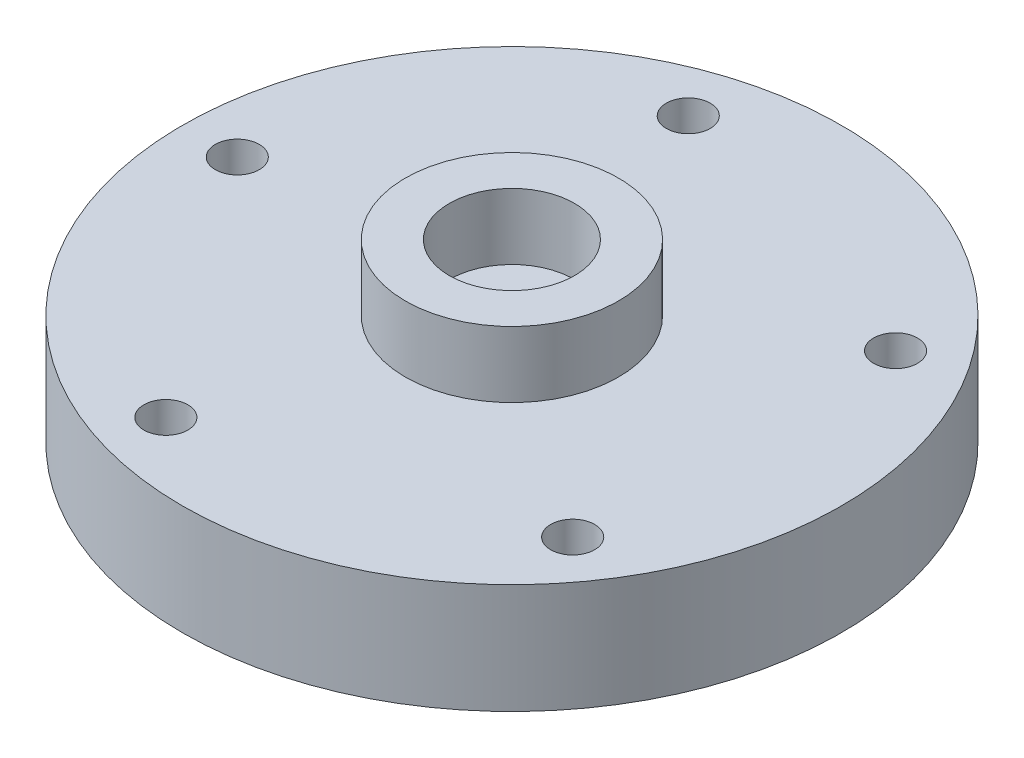
from build123d import *

# Parameters (mm, degrees)
BOSS_EXTRUDE1_DEPTH      = 2
BOSS_EXTRUDE1_DEPTH_BACK = 3
SKETCH1_R                = 15
SKETCH1_R_2              = 1
SKETCH2_R                = 4.85
SKETCH2_R_2              = 2.85
BOSS_EXTRUDE3_DEPTH      = 3
SKETCH5_R                = 2
CUT_EXTRUDE2_DEPTH       = 1


with BuildPart() as part:
    # Sketch1 → Boss-Extrude1 (new, two sides: drawn at the far end of the back side and taken through both)
    with BuildSketch(Plane(origin=(0, 0, 0), x_dir=(1, 0, 0), z_dir=(0, 1, 0)).offset(-BOSS_EXTRUDE1_DEPTH_BACK)):
        Circle(SKETCH1_R)
        with Locations((-12.5, 0)):
            Circle(SKETCH1_R_2, mode=Mode.SUBTRACT)
        with Locations((-3.86271243, 11.888206454)):
            Circle(SKETCH1_R_2, mode=Mode.SUBTRACT)
        with Locations((10.11271243, 7.347315654)):
            Circle(SKETCH1_R_2, mode=Mode.SUBTRACT)
        Circle(SKETCH1_R_2, mode=Mode.SUBTRACT)
        with Locations((-3.86271243, -11.888206454)):
            Circle(SKETCH1_R_2, mode=Mode.SUBTRACT)
        with Locations((10.11271243, -7.347315654)):
            Circle(SKETCH1_R_2, mode=Mode.SUBTRACT)
    extrude(amount=BOSS_EXTRUDE1_DEPTH + BOSS_EXTRUDE1_DEPTH_BACK)

    # Sketch2 → Boss-Extrude3 (add)
    with BuildSketch(Plane(origin=(0, 2, 0), x_dir=(1, 0, 0), z_dir=(0, 1, 0))):
        Circle(SKETCH2_R)
        Circle(SKETCH2_R_2, mode=Mode.SUBTRACT)
    extrude(amount=BOSS_EXTRUDE3_DEPTH)

    # Sketch5 → Cut-Extrude2 (cut)
    with BuildSketch(Plane.XZ.offset(3)):
        Circle(SKETCH5_R)
    extrude(amount=-CUT_EXTRUDE2_DEPTH, mode=Mode.SUBTRACT)


solid = part.part
